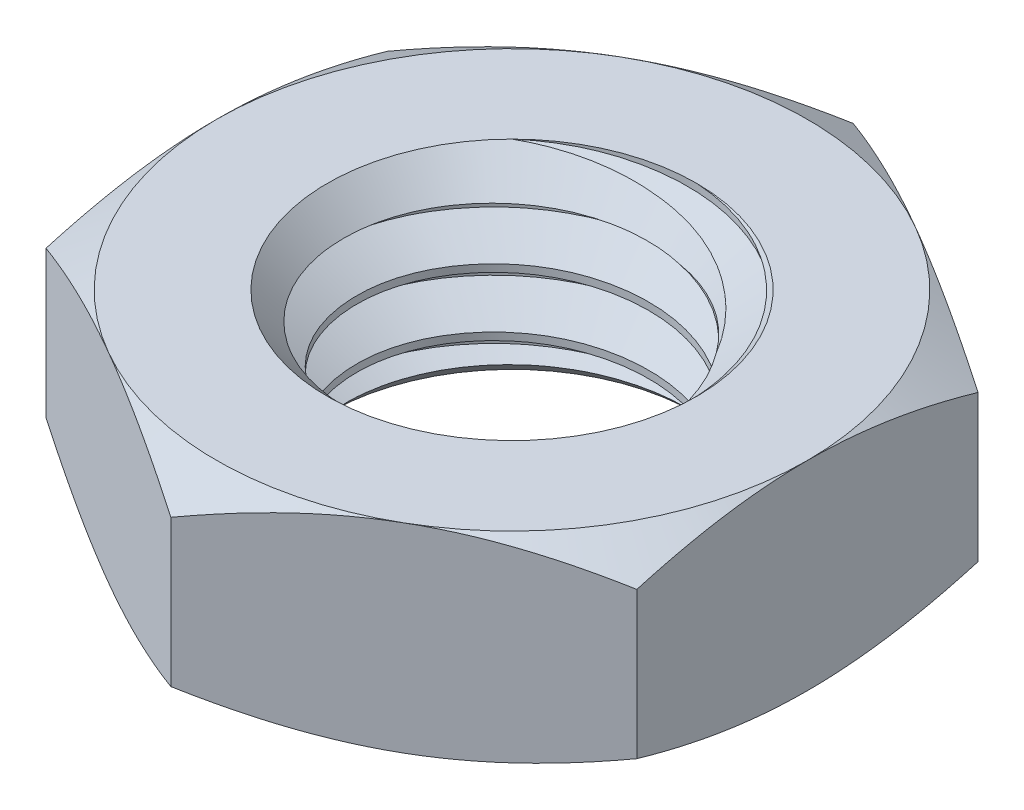
from build123d import *

# Parameters (mm, degrees)
SKETCH1_R                    = 2.5
BOSS_EXTRUDE1_DEPTH          = 1.35
SWEEP1_PITCH                 = 0.8
SWEEP1_FROM                  = 0
SWEEP1_TO                    = 2.7
SKETCH4_R                    = 2.5
CUT_EXTRUDE1_DEPTH           = 7.680070029
CUT_EXTRUDE1_OTHER_WAY_DEPTH = 7.680070029
CUT_EXTRUDE1_OTHER_WAY_DRAFT = -45
SKETCH5_OUTSIDE_W            = 39.108
SKETCH5_OUTSIDE_H            = 40.346
SKETCH5_OUTSIDE_R            = 4
CUT_EXTRUDE2_DEPTH           = 7.680070029
CUT_EXTRUDE2_DRAFT           = -60
MIRROR1_COPY_1_SKETCH_R      = 2.5
MIRROR1_COPY_1_DEPTH         = 7.680070029
MIRROR1_COPY_1_DRAFT         = -45
MIRROR1_COPY_2_SKETCH_R      = 2.5
MIRROR1_COPY_2_DEPTH         = 7.680070029
MIRROR1_COPY_2_DRAFT         = -45
MIRROR1_COPY_3_SKETCH_W      = 39.108
MIRROR1_COPY_3_SKETCH_H      = 40.346
MIRROR1_COPY_3_SKETCH_R      = 4
MIRROR1_COPY_3_DEPTH         = 7.680070029
MIRROR1_COPY_3_DRAFT         = -60


with BuildPart() as part:
    # Sketch1 → Boss-Extrude1 (new, symmetric)
    with BuildSketch(Plane(origin=(0, 0, 0), x_dir=(1, 0, 0), z_dir=(0, 1, 0))):
        Polygon((-4, 2.309401077), (-4, -2.309401077), (0, -4.618802154), (4, -2.309401077), (4, 2.309401077), (0, 4.618802154), align=None)
        Circle(SKETCH1_R, mode=Mode.SUBTRACT)
    extrude(amount=BOSS_EXTRUDE1_DEPTH, both=True)

    # Sweep1: arcs per turn and ends read off the stored shape
    # Sweep1: the profile of Sketch3 profile screwed along a right-hand helix through 4.375 turns, 8 arcs to a turn; built about Z, then put on its axis
    sweep1_z = Axis((0, 0, 0), (0, 0, 1))
    sweep1_corners = [(1.980384758, 0, -0.4), (2.5003, 0, -0.700173205), (2.5003, 0, 0.000173205), (1.980384758, 0, -0.3)]
    with BuildLine(mode=Mode.PRIVATE) as sweep1_profile:
        Line(sweep1_corners[0], sweep1_corners[1])
        Line(sweep1_corners[1], sweep1_corners[2])
        Line(sweep1_corners[2], sweep1_corners[3])
        Line(sweep1_corners[3], sweep1_corners[0])
    sweep1_cap = Face(sweep1_profile.wire())
    sweep1_turn_angles = [0, 22.5, 45, 67.5, 90, 112.5, 135, 157.5, 180, 202.5, 225, 247.5, 270, 292.5, 315, 337.5, 360]
    sweep1_turn_weights = [1, 0.9238795325112867, 1, 0.9238795325112867, 1, 0.9238795325112867, 1, 0.9238795325112867, 1, 0.9238795325112867, 1, 0.9238795325112867, 1, 0.9238795325112867, 1, 0.9238795325112867, 1]
    sweep1_turn_rails = [Edge.make_bspline([Vector(p[0], p[1], 0).rotate(sweep1_z, sweep1_turn_angles[k]) / sweep1_turn_weights[k] + Vector(0, 0, p[2] + SWEEP1_PITCH * sweep1_turn_angles[k] / 360) for k in range(17)], [0, 0, 0, 1, 1, 2, 2, 3, 3, 4, 4, 5, 5, 6, 6, 7, 7, 8, 8, 8], 2, sweep1_turn_weights) for p in sweep1_corners]
    sweep1_turn_sides = [Face.make_surface_from_curves(sweep1_turn_rails[p[0]], sweep1_turn_rails[p[1]]) for p in [(0, 1), (1, 2), (2, 3), (3, 0)]]
    sweep1_last_angles = [1440, 1462.5, 1485, 1507.5, 1530, 1552.5, 1575]
    sweep1_last_weights = [1, 0.9238795325112867, 1, 0.9238795325112867, 1, 0.9238795325112776, 1]
    sweep1_last_rails = [Edge.make_bspline([Vector(p[0], p[1], 0).rotate(sweep1_z, sweep1_last_angles[k]) / sweep1_last_weights[k] + Vector(0, 0, p[2] + SWEEP1_PITCH * sweep1_last_angles[k] / 360) for k in range(7)], [0, 0, 0, 1, 1, 2, 2, 3, 3, 3], 2, sweep1_last_weights) for p in sweep1_corners]
    sweep1_last_sides = [Face.make_surface_from_curves(sweep1_last_rails[p[0]], sweep1_last_rails[p[1]]) for p in [(0, 1), (1, 2), (2, 3), (3, 0)]]
    sweep1 = Plane(origin=(0, 1.35, 0), x_dir=(0, 0, -1), z_dir=(0, -1, 0)) * split(split(Solid(Shell([*[p.moved(Location((0, 0, SWEEP1_PITCH * i))) for i in range(4) for p in sweep1_turn_sides], *sweep1_last_sides, sweep1_cap, sweep1_cap.rotate(sweep1_z, 1575).moved(Location((0, 0, SWEEP1_PITCH * 1575 / 360)))])), bisect_by=Plane.XY.offset(SWEEP1_FROM), keep=Keep.TOP, mode=Mode.PRIVATE), bisect_by=Plane.XY.offset(SWEEP1_TO), keep=Keep.BOTTOM, mode=Mode.PRIVATE)
    add(sweep1)

    # Sketch4 → Cut-Extrude1 (cut)
    with BuildSketch(Plane(origin=(0, 1.35, 0), x_dir=(1, 0, 0), z_dir=(0, 1, 0))):
        Circle(SKETCH4_R)
    cut_extrude1 = extrude(amount=CUT_EXTRUDE1_DEPTH, mode=Mode.SUBTRACT)


with BuildPart() as cut_extrude1_other_way_tool:
    # Sketch4 → Cut-Extrude1 other way (with draft: the straight prism first)
    with BuildSketch(Plane(origin=(0, 1.35, 0), x_dir=(1, 0, 0), z_dir=(0, 1, 0))):
        Circle(SKETCH4_R)
    extrude(amount=-CUT_EXTRUDE1_OTHER_WAY_DEPTH)
    # Cut-Extrude1 other way: the draft: its side faces are tilted about the plane it starts from
    cut_extrude1_other_way_sides = [cut_extrude1_other_way_tool.faces().sort_by_distance(p)[0] for p in [
        (-2.5, -2.490035015, 0),
    ]]
    draft(cut_extrude1_other_way_sides, Plane(origin=(0, 1.35, 0), x_dir=(1, 0, 0), z_dir=(0, 1, 0)), CUT_EXTRUDE1_OTHER_WAY_DRAFT)


with BuildPart() as part_1:
    add(part.part)

    # Cut-Extrude1 other way: cut by cut_extrude1_other_way_tool
    add(cut_extrude1_other_way_tool.part, mode=Mode.SUBTRACT)


with BuildPart() as cut_extrude2_tool:
    # Sketch5 outside → Cut-Extrude2 (with draft: the straight prism first)
    with BuildSketch(Plane(origin=(0, 1.35, 0), x_dir=(1, 0, 0), z_dir=(0, 1, 0))):
        Rectangle(SKETCH5_OUTSIDE_W, SKETCH5_OUTSIDE_H)
        Circle(SKETCH5_OUTSIDE_R, mode=Mode.SUBTRACT)
    extrude(amount=-CUT_EXTRUDE2_DEPTH)
    # Cut-Extrude2: the draft: its side faces are tilted about the plane it starts from
    cut_extrude2_sides = [cut_extrude2_tool.faces().sort_by_distance(p)[0] for p in [
        (0, -2.490035015, 20.173),
        (19.554, -2.490035015, 0),
        (0, -2.490035015, -20.173),
        (-19.554, -2.490035015, 0),
        (-4, -2.490035015, 0),
    ]]
    draft(cut_extrude2_sides, Plane(origin=(0, 1.35, 0), x_dir=(1, 0, 0), z_dir=(0, 1, 0)), CUT_EXTRUDE2_DRAFT)


with BuildPart() as part_2:
    add(part_1.part)

    # Cut-Extrude2: cut by cut_extrude2_tool
    add(cut_extrude2_tool.part, mode=Mode.SUBTRACT)

    # Mirror1: Cut-Extrude1 across plane
    add(cut_extrude1.mirror(Plane.ZX), mode=Mode.SUBTRACT)


with BuildPart() as mirror1_copy_1_tool:
    # Mirror1 copy 1 sketch → Mirror1 copy 1 (with draft: the straight prism first)
    with BuildSketch(Plane.XZ.offset(1.35)):
        Circle(MIRROR1_COPY_1_SKETCH_R)
    extrude(amount=-MIRROR1_COPY_1_DEPTH)
    # Mirror1 copy 1: the draft: its side faces are tilted about the plane it starts from
    mirror1_copy_1_sides = [mirror1_copy_1_tool.faces().sort_by_distance(p)[0] for p in [
        (-2.5, 2.490035015, 0),
    ]]
    draft(mirror1_copy_1_sides, Plane.XZ.offset(1.35), MIRROR1_COPY_1_DRAFT)


with BuildPart() as part_3:
    add(part_2.part)

    # Mirror1 copy 1: cut by mirror1_copy_1_tool
    add(mirror1_copy_1_tool.part, mode=Mode.SUBTRACT)


with BuildPart() as mirror1_copy_2_tool:
    # Mirror1 copy 2 sketch → Mirror1 copy 2 (with draft: the straight prism first)
    with BuildSketch(Plane.XZ.offset(1.35)):
        Circle(MIRROR1_COPY_2_SKETCH_R)
    extrude(amount=-MIRROR1_COPY_2_DEPTH)
    # Mirror1 copy 2: the draft: its side faces are tilted about the plane it starts from
    mirror1_copy_2_sides = [mirror1_copy_2_tool.faces().sort_by_distance(p)[0] for p in [
        (-2.5, 2.490035015, 0),
    ]]
    draft(mirror1_copy_2_sides, Plane.XZ.offset(1.35), MIRROR1_COPY_2_DRAFT)


with BuildPart() as part_4:
    add(part_3.part)

    # Mirror1 copy 2: cut by mirror1_copy_2_tool
    add(mirror1_copy_2_tool.part, mode=Mode.SUBTRACT)


with BuildPart() as mirror1_copy_3_tool:
    # Mirror1 copy 3 sketch → Mirror1 copy 3 (with draft: the straight prism first)
    with BuildSketch(Plane.XZ.offset(1.35)):
        Rectangle(MIRROR1_COPY_3_SKETCH_W, MIRROR1_COPY_3_SKETCH_H)
        Circle(MIRROR1_COPY_3_SKETCH_R, mode=Mode.SUBTRACT)
    extrude(amount=-MIRROR1_COPY_3_DEPTH)
    # Mirror1 copy 3: the draft: its side faces are tilted about the plane it starts from
    mirror1_copy_3_sides = [mirror1_copy_3_tool.faces().sort_by_distance(p)[0] for p in [
        (0, 2.490035015, 20.173),
        (19.554, 2.490035015, 0),
        (0, 2.490035015, -20.173),
        (-19.554, 2.490035015, 0),
        (-4, 2.490035015, 0),
    ]]
    draft(mirror1_copy_3_sides, Plane.XZ.offset(1.35), MIRROR1_COPY_3_DRAFT)


with BuildPart() as part_5:
    add(part_4.part)

    # Mirror1 copy 3: cut by mirror1_copy_3_tool
    add(mirror1_copy_3_tool.part, mode=Mode.SUBTRACT)


solid = part_5.part
